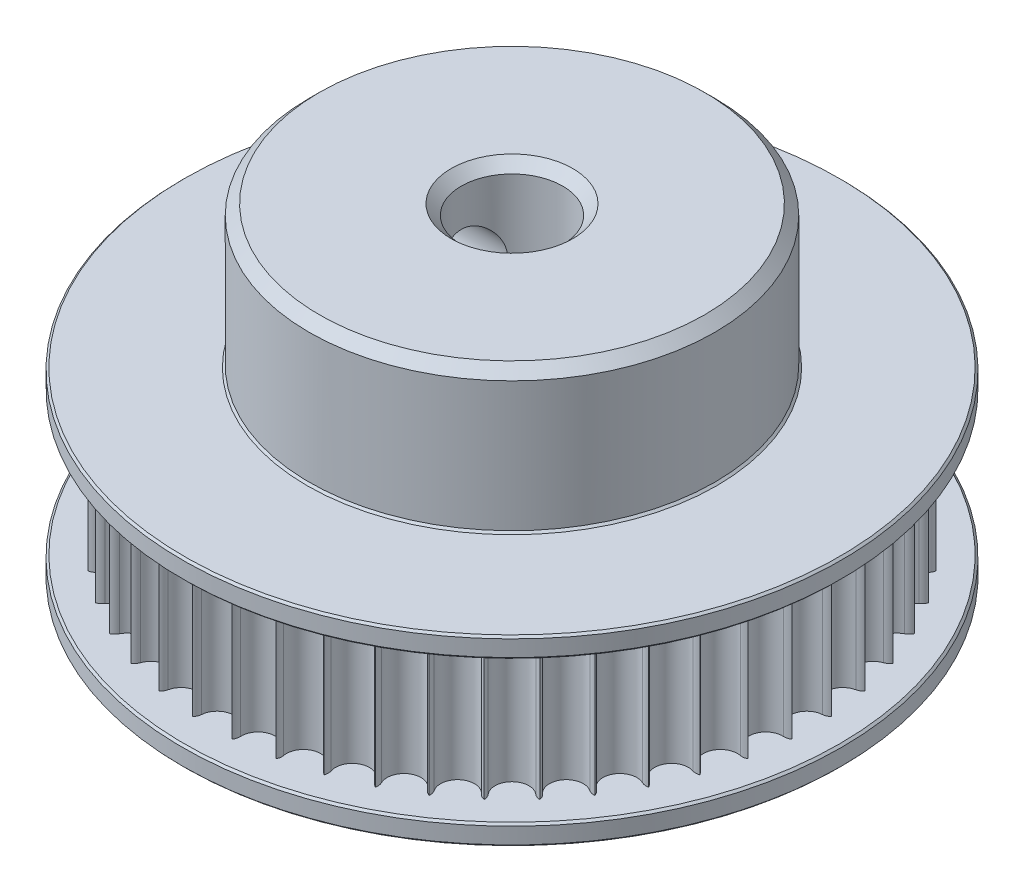
from build123d import *

# Parameters (mm, degrees)
CUT_EXTRUDE3_DEPTH      = 7
CIRPATTERN1_COUNT       = 48
CUT_EXTRUDE2_REACH      = 26.503
CUT_EXTRUDE2_END_RADIUS = 10
SKETCH3_R               = 1.65
CHAMFER1_SIZE           = 1
CHAMFER2_SIZE           = 0.5
CHAMFER3_SIZE           = 0.1


with BuildPart() as part:
    # Skica2 → Revolute (revolve)
    with BuildSketch(Plane.XY):
        Polygon((10, 8.5), (2.5, 8.5), (2.5, -8.5), (3.5, -8.5), (3.5, -7.5), (16.25, -7.5), (16.25, -6.5), (15, -6.5), (15, 0.5), (16.25, 0.5), (16.25, 1.5), (10, 1.5), align=None)
    revolve(axis=Axis((0, -8.5, 0), (0, 1, 0)))

    # Sketch2 → Cut-Extrude3 (cut)
    with BuildSketch(Plane.XZ.offset(-0.5)):
        with BuildLine():
            ThreePointArc((-0.833640807, 14.47601613), (0, 13.702484591), (0.833640807, 14.47601613))
            ThreePointArc((0.833640807, 14.47601613), (1.009366856, 14.820440419), (1.3781834, 14.936552832))
            ThreePointArc((1.3781834, 14.936552832), (1.764990816, 14.895798314), (2.150611523, 14.845028463))
            ThreePointArc((2.150611523, 14.845028463), (1.524694668, 16.249622788), (0, 16.449531011))
            ThreePointArc((0, 16.449531011), (-1.524694668, 16.249622788), (-2.150611523, 14.845028463))
            ThreePointArc((-2.150611523, 14.845028463), (-1.764990816, 14.895798314), (-1.3781834, 14.936552832))
            ThreePointArc((-1.3781834, 14.936552832), (-1.009366856, 14.820440419), (-0.833640807, 14.47601613))
        make_face()
    cut_extrude3 = extrude(amount=CUT_EXTRUDE3_DEPTH, mode=Mode.SUBTRACT)

    # CirPattern1: Cut-Extrude3 ×48 about axis
    cirpattern1_axis = Axis((0, 0, 0), (0, 1, 0))
    for i in range(1, CIRPATTERN1_COUNT):
        add(cut_extrude3.rotate(cirpattern1_axis, i * 360 / CIRPATTERN1_COUNT), mode=Mode.SUBTRACT)

    # Cut-Extrude2: up to this cylinder (the profile starts inside it)
    cut_extrude2_end = Plane(origin=(0, 4.5, 0), z_dir=(0, -1, 0)) * Cylinder(CUT_EXTRUDE2_END_RADIUS, 74.006, mode=Mode.PRIVATE)
    # Sketch3 → Cut-Extrude2 (cut, up to the surface)
    with BuildSketch(Plane(origin=(0, 0, 0), x_dir=(0, 0, -1), z_dir=(1, 0, 0)), mode=Mode.PRIVATE) as cut_extrude2_sk1:
        with Locations((0, 4.5)):
            Circle(SKETCH3_R)
    cut_extrude2_tool1 = extrude(cut_extrude2_sk1.sketch, amount=-CUT_EXTRUDE2_REACH, mode=Mode.PRIVATE) & cut_extrude2_end
    add(cut_extrude2_tool1.solids().sort_by_distance((0, 4.5, 0))[0], mode=Mode.SUBTRACT)

    # Chamfer1
    chamfer1_edges = [part.edges().sort_by_distance(p)[0] for p in [
        (-3.5, -7.5, 0),
    ]]
    chamfer(chamfer1_edges, length=CHAMFER1_SIZE - 0.0001)  # a hair under: the kernel refuses the full size

    # Chamfer2
    chamfer2_edges = [part.edges().sort_by_distance(p)[0] for p in [
        (-2.5, 8.5, 0),
        (-10, 8.5, 0),
    ]]
    chamfer(chamfer2_edges, length=CHAMFER2_SIZE)

    # Chamfer3
    chamfer3_edges = [part.edges().sort_by_distance(p)[0] for p in [
        (-16.25, 0.5, 0),
        (-16.25, -6.5, 0),
        (-16.25, -7.5, 0),
        (-10, 1.5, 0),
        (-16.25, 1.5, 0),
    ]]
    chamfer(chamfer3_edges, length=CHAMFER3_SIZE)


solid = part.part
